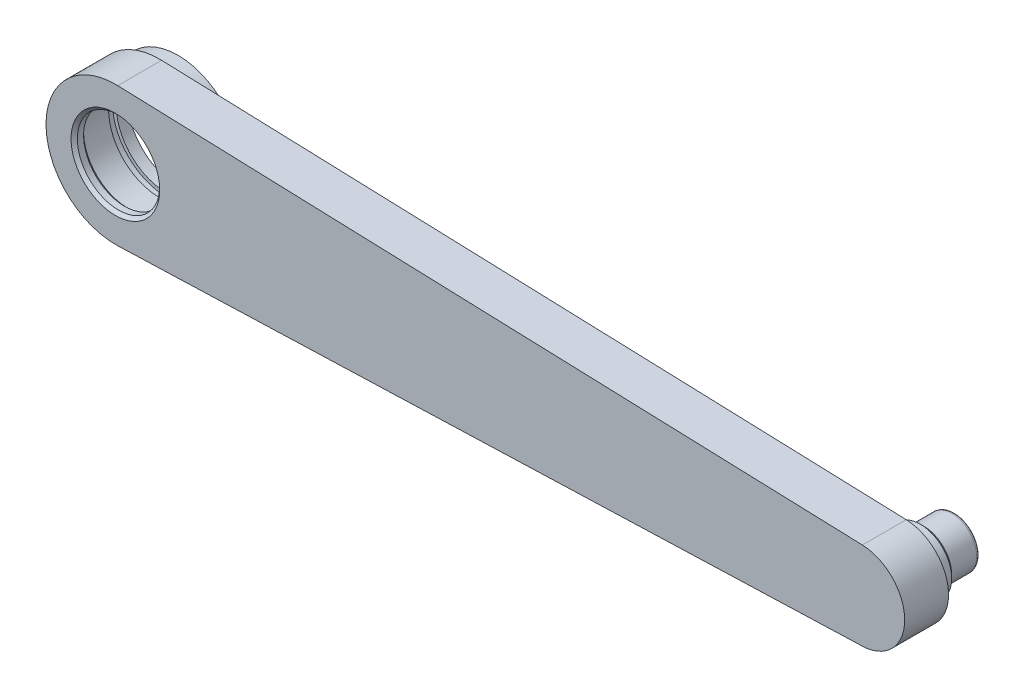
from build123d import *

# Parameters (mm, degrees)
SKETCH_1_R          = 8.075
EXTRUDE_1_DEPTH     = 7
EXTRUDE_START       = -2
SKETCH_2_R          = 8.075
SKETCH_2_R_2        = 6.575
EXTRUDE_2_DEPTH     = 2
SKETCH_3_R          = 4
EXTRUDE_3_DEPTH     = 10
SKETCH_4_R          = 5
SKETCH_4_R_2        = 4
EXTRUDE_4_DEPTH     = 3
CHAMFER_1_SIZE      = 0.5
CUT_EXTRUDE_1_DEPTH = 7
CUT_EXTRUDE_2_DEPTH = 5
CUT_EXTRUDE_START   = -2
SKETCH_8_R          = 4
CUT_EXTRUDE_3_DEPTH = 2
FILLET_1_R          = 0.5
SKETCH_9_R          = 2.2
CUT_EXTRUDE_4_DEPTH = 10
EXTRUDE_START_2     = 3
SKETCH_10_R         = 10.075
SKETCH_10_R_2       = 8.075
EXTRUDE_5_DEPTH     = 3
EXTRUDE_6_DEPTH     = 2
EXTRUDE_START_3     = 5
EXTRUDE_7_DEPTH     = 5


with BuildPart() as part:
    # 草图1 → 凸台-拉伸1 (new body)
    with BuildSketch(Plane.XY):
        with BuildLine():
            ThreePointArc((0.37924895, 11.068504652), (-11.074999998, -0.000191538), (0.379631801, -11.068491528))
            Line((0.379631801, -11.068491528), (119, -7))
            ThreePointArc((119, -7), (125.998973572, -0.119870518), (119.239705882, 6.995894588))
            Line((119.239705882, 6.995894588), (0.37924895, 11.068504652))
        make_face()
        Circle(SKETCH_1_R, mode=Mode.SUBTRACT)
    extrude(amount=EXTRUDE_1_DEPTH)

    # 草图2 → 凸台-拉伸2 (add)
    with BuildSketch(Plane.XY.offset(7).offset(EXTRUDE_START)):
        Circle(SKETCH_2_R)
        Circle(SKETCH_2_R_2, mode=Mode.SUBTRACT)
    extrude(amount=EXTRUDE_2_DEPTH)

    # 草图3 → 凸台-拉伸3 (add)
    with BuildSketch(Plane(origin=(0, 0, 0), x_dir=(-1, 0, 0), z_dir=(0, 0, -1))):
        with Locations((-119, 0)):
            Circle(SKETCH_3_R)
    extrude(amount=EXTRUDE_3_DEPTH)

    # 草图4 → 凸台-拉伸4 (add)
    with BuildSketch(Plane(origin=(0, 0, 0), x_dir=(-1, 0, 0), z_dir=(0, 0, -1))):
        with Locations(Location((-119, 0, 0), (0, 0, 180))):
            Circle(SKETCH_4_R)
        with Locations((-119, 0)):
            Circle(SKETCH_4_R_2, mode=Mode.SUBTRACT)
    extrude(amount=EXTRUDE_4_DEPTH)

    # 倒角1
    chamfer_1_edges = [part.edges().sort_by_distance(p)[0] for p in [
        (-6.575, 0, 5),
        (-6.575, 0, 7),
        (123, 0, -10),
        (114, 0, -3),
    ]]
    chamfer(chamfer_1_edges, length=CHAMFER_1_SIZE)

    # 草图5 → 切除-拉伸1 (cut)
    with BuildSketch(Plane(origin=(0, 0, 0), x_dir=(-1, 0, 0), z_dir=(0, 0, -1))):
        with BuildLine():
            ThreePointArc((-12.757234161, -4.640431182), (-13.574999998, 0.000234775), (-12.757073645, 4.640872443))
            Line((-12.757073645, 4.640872443), (-109.090204802, 1.340134001))
            ThreePointArc((-109.090204802, 1.340134001), (-109.022576686, 0.671583213), (-109, 0))
            ThreePointArc((-109, 0), (-109.022449652, -0.669693251), (-109.08969781, -1.336379625))
            Line((-109.08969781, -1.336379625), (-12.757234161, -4.640431182))
        make_face()
    extrude(amount=-CUT_EXTRUDE_1_DEPTH, mode=Mode.SUBTRACT)

    # 草图6 → 切除-拉伸2 (cut)
    with BuildSketch(Plane(origin=(0, 0, 0), x_dir=(-1, 0, 0), z_dir=(0, 0, -1))):
        Polygon((-109.08969781, -1.336379625), (-12.757234161, -4.640431182), (-12.860068961, -7.638668165), (-109.192532609, -4.334616608), align=None)
        Polygon((-12.757073645, 4.640872443), (-109.090204802, 1.340134001), (-109.192935895, 4.338374538), (-12.859804737, 7.63911298), align=None)
    extrude(amount=-CUT_EXTRUDE_2_DEPTH, mode=Mode.SUBTRACT)

    # 草图8 → 切除-拉伸3 (cut)
    with BuildSketch(Plane(origin=(0, 0, -10), x_dir=(-1, 0, 0), z_dir=(0, 0, -1)).offset(CUT_EXTRUDE_START)):
        with Locations((-119, 0)):
            Circle(SKETCH_8_R)
    extrude(amount=CUT_EXTRUDE_3_DEPTH, mode=Mode.SUBTRACT)

    # 圆角1
    fillet_1_edges = [part.edges().sort_by_distance(p)[0] for p in [
        (123, 0, -8),
    ]]
    fillet(fillet_1_edges, radius=FILLET_1_R)

    # 草图9 → 切除-拉伸4 (cut)
    with BuildSketch(Plane(origin=(0, 0, -8), x_dir=(-1, 0, 0), z_dir=(0, 0, -1))):
        with Locations((-119, 0)):
            Circle(SKETCH_9_R)
    extrude(amount=-CUT_EXTRUDE_4_DEPTH, mode=Mode.SUBTRACT)

    # 草图10 → 凸台-拉伸5 (add)
    with BuildSketch(Plane(origin=(0, 0, 0), x_dir=(-1, 0, 0), z_dir=(0, 0, -1)).offset(EXTRUDE_START_2)):
        with Locations(Location((0, 0, 0), (0, 0, 180))):
            Circle(SKETCH_10_R)
        Circle(SKETCH_10_R_2, mode=Mode.SUBTRACT)
    extrude(amount=-EXTRUDE_5_DEPTH)

    # 切除-旋转2: read off the stored shape, not the designer's step
    # 切除-旋转2: loft between two sections, ruled curve by curve
    cut_revolve_2_from = [
        Edge.make_three_point_arc((8.65, 0, -1.2), (0, 8.65, -1.2), (-8.65, 0, -1.2)),
        Edge.make_three_point_arc((-8.65, 0, -1.2), (0, -8.65, -1.2), (8.65, 0, -1.2)),
    ]
    cut_revolve_2_to = [
        Edge.make_three_point_arc((8.65, 0, 0), (0, 8.65, 0), (-8.65, 0, 0)),
        Edge.make_three_point_arc((-8.65, 0, 0), (0, -8.65, 0), (8.65, 0, 0)),
    ]
    cut_revolve_2 = Solid(Shell([*[Face.make_surface_from_curves(cut_revolve_2_from[k], cut_revolve_2_to[k]) for k in range(2)], Face(Wire(cut_revolve_2_from)), Face(Wire(cut_revolve_2_to))]))
    add(cut_revolve_2, mode=Mode.SUBTRACT)

    # 草图12 → 凸台-拉伸6 (add)
    with BuildSketch(Plane.XY.offset(7).offset(EXTRUDE_START)):
        with BuildLine():
            Line((109.08969781, -1.336379625), (12.757234161, -4.640431182))
            ThreePointArc((12.757234161, -4.640431182), (13.574999998, 0.000234775), (12.757073645, 4.640872443))
            Line((12.757073645, 4.640872443), (109.090204802, 1.340134001))
            ThreePointArc((109.090204802, 1.340134001), (109.000000179, 0.001894226), (109.08969781, -1.336379625))
        make_face()
    extrude(amount=EXTRUDE_6_DEPTH)

    # 草图13 → 凸台-拉伸7 (add)
    with BuildSketch(Plane(origin=(0, 0, 5), x_dir=(-1, 0, 0), z_dir=(0, 0, -1)).offset(EXTRUDE_START_3)):
        with BuildLine():
            Line((-109.08969781, -1.336379625), (-109.192532609, -4.334616608))
            Line((-109.192532609, -4.334616608), (-12.860068961, -7.638668165))
            Line((-12.860068961, -7.638668165), (-12.757234161, -4.640431182))
            ThreePointArc((-12.757234161, -4.640431182), (-13.574999998, 0.000234775), (-12.757073645, 4.640872443))
            Line((-12.757073645, 4.640872443), (-12.859804737, 7.63911298))
            Line((-12.859804737, 7.63911298), (-109.192935895, 4.338374538))
            Line((-109.192935895, 4.338374538), (-109.090204802, 1.340134001))
            ThreePointArc((-109.090204802, 1.340134001), (-109.000000179, 0.001894226), (-109.08969781, -1.336379625))
        make_face()
    extrude(amount=-EXTRUDE_7_DEPTH)


solid = part.part
